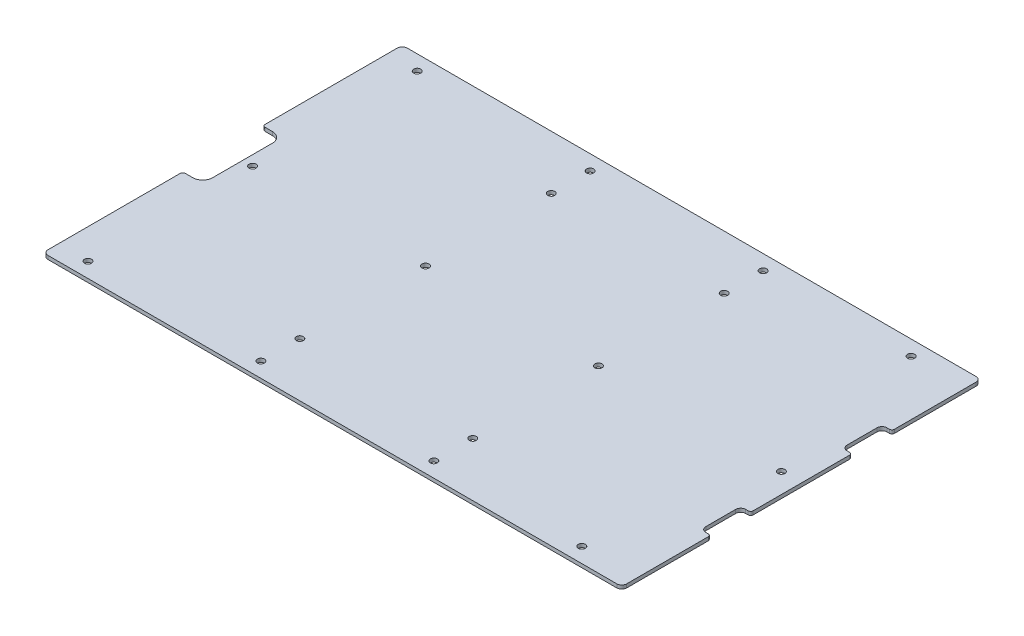
from build123d import *

# Parameters (mm, degrees)
SKETCH1_R           = 2.2479
BOSS_EXTRUDE1_DEPTH = 2.286
CUT_EXTRUDE1_DEPTH  = 217.750866886
FILLET1_R           = 1.5875


with BuildPart() as part:
    # Sketch1 → Boss-Extrude1 (new body)
    with BuildSketch(Plane(origin=(0, 0, 0), x_dir=(1, 0, 0), z_dir=(0, 1, 0))):
        with BuildLine():
            Line((-180.975, 114.3), (180.975, 114.3))
            ThreePointArc((180.975, 114.3), (183.22006403, 113.37006403), (184.15, 111.125))
            Line((184.15, 111.125), (184.15, -111.125))
            ThreePointArc((184.15, -111.125), (183.22006403, -113.37006403), (180.975, -114.3))
            Line((180.975, -114.3), (-180.975, -114.3))
            ThreePointArc((-180.975, -114.3), (-183.22006403, -113.37006403), (-184.15, -111.125))
            Line((-184.15, -111.125), (-184.15, 111.125))
            ThreePointArc((-184.15, 111.125), (-183.22006403, 113.37006403), (-180.975, 114.3))
        make_face()
        with Locations((-165.1, 104.775)):
            Circle(SKETCH1_R, mode=Mode.SUBTRACT)
        with Locations((-55.033333333, 104.775)):
            Circle(SKETCH1_R, mode=Mode.SUBTRACT)
        with Locations((55.033333333, 104.775)):
            Circle(SKETCH1_R, mode=Mode.SUBTRACT)
        with Locations((55.033333333, -104.775)):
            Circle(SKETCH1_R, mode=Mode.SUBTRACT)
        with Locations((-55.033333333, -104.775)):
            Circle(SKETCH1_R, mode=Mode.SUBTRACT)
        with Locations((-165.1, -104.775)):
            Circle(SKETCH1_R, mode=Mode.SUBTRACT)
        with Locations((-55.033333333, 0)):
            Circle(SKETCH1_R, mode=Mode.SUBTRACT)
        with Locations((55.033333333, 0)):
            Circle(SKETCH1_R, mode=Mode.SUBTRACT)
        with Locations((149.225, -104.775)):
            Circle(SKETCH1_R, mode=Mode.SUBTRACT)
        with Locations((149.225, 104.775)):
            Circle(SKETCH1_R, mode=Mode.SUBTRACT)
        with Locations((55.0291, -80.01)):
            Circle(SKETCH1_R, mode=Mode.SUBTRACT)
        with Locations((-55.0291, -80.01)):
            Circle(SKETCH1_R, mode=Mode.SUBTRACT)
        with Locations((-55.0291, 80.01)):
            Circle(SKETCH1_R, mode=Mode.SUBTRACT)
        with Locations((55.0291, 80.01)):
            Circle(SKETCH1_R, mode=Mode.SUBTRACT)
        with Locations((171.45, 0)):
            Circle(SKETCH1_R, mode=Mode.SUBTRACT)
        with Locations((-165.1, 0)):
            Circle(SKETCH1_R, mode=Mode.SUBTRACT)
    extrude(amount=BOSS_EXTRUDE1_DEPTH)

    # Sketch2 → Cut-Extrude1 (cut, through all)
    with BuildSketch(Plane.XZ):
        with BuildLine():
            Line((184.15, 57.658), (180.975, 57.658))
            ThreePointArc((180.975, 57.658), (178.72993597, 56.72806403), (177.8, 54.483))
            Line((177.8, 54.483), (177.8, 35.433))
            ThreePointArc((177.8, 35.433), (178.72993597, 33.18793597), (180.975, 32.258))
            Line((180.975, 32.258), (184.15, 32.258))
            Line((184.15, 32.258), (184.15, 57.658))
        make_face()
        with BuildLine():
            Line((184.15, -32.258), (180.975, -32.258))
            ThreePointArc((180.975, -32.258), (178.72993597, -33.18793597), (177.8, -35.433))
            Line((177.8, -35.433), (177.8, -54.483))
            ThreePointArc((177.8, -54.483), (178.72993597, -56.72806403), (180.975, -57.658))
            Line((180.975, -57.658), (184.15, -57.658))
            Line((184.15, -57.658), (184.15, -32.258))
        make_face()
        with BuildLine():
            Line((-184.15, 25.4), (-177.8, 25.4))
            ThreePointArc((-177.8, 25.4), (-173.309871939, 23.540128061), (-171.45, 19.05))
            Line((-171.45, 19.05), (-171.45, -19.05))
            ThreePointArc((-171.45, -19.05), (-173.309871939, -23.540128061), (-177.8, -25.4))
            Line((-177.8, -25.4), (-184.15, -25.4))
            Line((-184.15, -25.4), (-184.15, 25.4))
        make_face()
    extrude(amount=-CUT_EXTRUDE1_DEPTH, mode=Mode.SUBTRACT)

    # Fillet1
    fillet1_edges = [part.edges().sort_by_distance(p)[0] for p in [
        (184.15, 1.143, -57.658),
        (184.15, 1.143, -32.258),
        (184.15, 1.143, 32.258),
        (184.15, 1.143, 57.658),
        (-184.15, 1.143, -25.4),
        (-184.15, 1.143, 25.4),
    ]]
    fillet(fillet1_edges, radius=FILLET1_R)


solid = part.part
